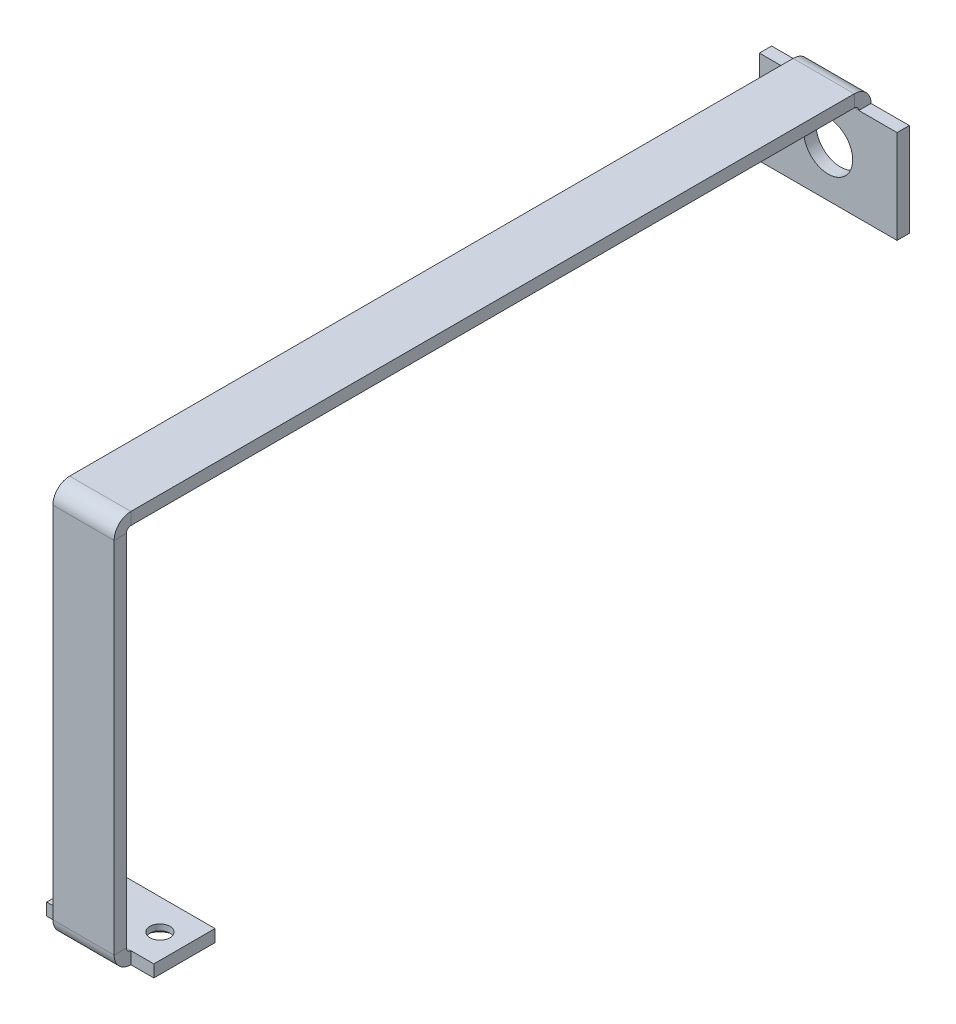
from build123d import *

# Parameters (mm, degrees)
SKETCH1_W                                         = 17.5
SKETCH1_H                                         = 10
BASE_FLANGE1_DEPTH                                = 2
EDGE_FLANGE1_DEPTH                                = 10
EDGE_FLANGE2_STRIP_W                              = 9.4732
EDGE_FLANGE2_STRIP_H                              = 2
EDGE_FLANGE2_STRIP_CUT_DEPTH                      = 10
EDGE_FLANGE2_DEPTH                                = 10
EDGE_FLANGE3_STRIP_W                              = 9.4732
EDGE_FLANGE3_STRIP_H                              = 2
EDGE_FLANGE3_STRIP_CUT_DEPTH                      = 10
EDGE_FLANGE3_DEPTH                                = 10
EDGE_FLANGE3_PROFILE_W                            = 22.5
EDGE_FLANGE3_PROFILE_H                            = 15.2634
EDGE_FLANGE3_FLAT_DEPTH                           = 2
SKETCH18_R                                        = 4
CUT_EXTRUDE2_DEPTH                                = 2
CSK_FOR_4_FLAT_HEAD_MACHINE_SCREW_100_D           = 3.2639
CSK_FOR_4_FLAT_HEAD_MACHINE_SCREW_100_DEPTH       = 2
CSK_FOR_4_FLAT_HEAD_MACHINE_SCREW_100_CSINK_D     = 5.715
CSK_FOR_4_FLAT_HEAD_MACHINE_SCREW_100_CSINK_ANGLE = 100
CSK_FOR_4_FLAT_HEAD_MACHINE_SCREW_100_TIP         = 0.980574487


# Sheet-metal steps are written as plain solids
with BuildPart() as part:
    # Sketch1 → Base-Flange1 (new body)
    with BuildSketch(Plane(origin=(0, 0, 0), x_dir=(1, 0, 0), z_dir=(0, 1, 0))):
        Rectangle(SKETCH1_W, SKETCH1_H)
    extrude(amount=BASE_FLANGE1_DEPTH)

    # Edge-Flange1 section (across the edge) → Edge-Flange1 (add)
    with BuildSketch(Plane(origin=(-5, 2, 5.7366), x_dir=(0, 0, -1), z_dir=(1, 0, 0))):
        with BuildLine():
            Line((-2, 0.7366), (-2, 62.15))
            Line((-2, 62.15), (0, 62.15))
            Line((0, 62.15), (0, 0.7366))
            ThreePointArc((0, 0.7366), (0.215745145, 0.215745145), (0.7366, 0))
            Line((0.7366, 0), (0.7366, -2))
            ThreePointArc((0.7366, -2), (-1.198468417, -1.198468417), (-2, 0.7366))
        make_face()
    extrude(amount=EDGE_FLANGE1_DEPTH)

    # Edge-Flange2 strip (across the edge) → Edge-Flange2 strip cut (cut)
    with BuildSketch(Plane(origin=(-5, 64.15, 5.7366), x_dir=(0, -1, 0), z_dir=(1, 0, 0))):
        with Locations((-2, -1)):
            Rectangle(EDGE_FLANGE2_STRIP_W, EDGE_FLANGE2_STRIP_H)
    extrude(amount=EDGE_FLANGE2_STRIP_CUT_DEPTH, mode=Mode.SUBTRACT)

    # Edge-Flange2 section (across the edge) → Edge-Flange2 (add)
    with BuildSketch(Plane(origin=(-5, 64.15, 5.7366), x_dir=(0, -1, 0), z_dir=(1, 0, 0))):
        with BuildLine():
            Line((0, 0.7366), (0, 121.685))
            Line((0, 121.685), (2, 121.685))
            Line((2, 121.685), (2, 0.7366))
            ThreePointArc((2, 0.7366), (2.215745145, 0.215745145), (2.7366, 0))
            Line((2.7366, 0), (2.7366, -2))
            ThreePointArc((2.7366, -2), (0.801531583, -1.198468417), (0, 0.7366))
        make_face()
    extrude(amount=EDGE_FLANGE2_DEPTH)

    # Edge-Flange3 strip (across the edge) → Edge-Flange3 strip cut (cut)
    with BuildSketch(Plane(origin=(-5, 62.15, -115.9484), x_dir=(0, 0, 1), z_dir=(1, 0, 0))):
        with Locations((-2, -1)):
            Rectangle(EDGE_FLANGE3_STRIP_W, EDGE_FLANGE3_STRIP_H)
    extrude(amount=EDGE_FLANGE3_STRIP_CUT_DEPTH, mode=Mode.SUBTRACT)

    # Edge-Flange3 bend section (across the edge) → Edge-Flange3 (add)
    with BuildSketch(Plane(origin=(-5, 62.15, -115.9484), x_dir=(0, 0, 1), z_dir=(1, 0, 0))):
        with BuildLine():
            Line((0, 0.7366), (2, 0.7366))
            ThreePointArc((2, 0.7366), (2.215745145, 0.215745145), (2.7366, 0))
            Line((2.7366, 0), (2.7366, -2))
            ThreePointArc((2.7366, -2), (0.801531583, -1.198468417), (0, 0.7366))
        make_face()
    extrude(amount=EDGE_FLANGE3_DEPTH)

    # Edge-Flange3 profile (on flange) → Edge-Flange3 flat (add)
    with BuildSketch(Plane(origin=(0, 62.15, -115.9484), x_dir=(1, 0, 0), z_dir=(0, 0, -1))):
        with Locations((0, 8.3683)):
            Rectangle(EDGE_FLANGE3_PROFILE_W, EDGE_FLANGE3_PROFILE_H)
    extrude(amount=-EDGE_FLANGE3_FLAT_DEPTH)

    # Sketch18 → Cut-Extrude2 (cut)
    with BuildSketch(Plane(origin=(0, 0, -115.9484), x_dir=(-1, 0, 0), z_dir=(0, 0, -1))):
        with Locations(Location((0, 53.9134, 0), (0, 0, 90))):
            Circle(SKETCH18_R)
    extrude(amount=-CUT_EXTRUDE2_DEPTH, mode=Mode.SUBTRACT)

    # CSK for #4 Flat Head Machine Screw (100)1
    with Locations(Plane.XZ):
        with Locations((4.75, 0), (-4.75, 0)):
            CounterSinkHole(CSK_FOR_4_FLAT_HEAD_MACHINE_SCREW_100_D / 2, CSK_FOR_4_FLAT_HEAD_MACHINE_SCREW_100_CSINK_D / 2, depth=CSK_FOR_4_FLAT_HEAD_MACHINE_SCREW_100_DEPTH, counter_sink_angle=CSK_FOR_4_FLAT_HEAD_MACHINE_SCREW_100_CSINK_ANGLE)
            with Locations((0, 0, -(CSK_FOR_4_FLAT_HEAD_MACHINE_SCREW_100_DEPTH + CSK_FOR_4_FLAT_HEAD_MACHINE_SCREW_100_TIP / 2))):  # 118° drill point
                Cone(0, CSK_FOR_4_FLAT_HEAD_MACHINE_SCREW_100_D / 2, CSK_FOR_4_FLAT_HEAD_MACHINE_SCREW_100_TIP, mode=Mode.SUBTRACT)


solid = part.part
